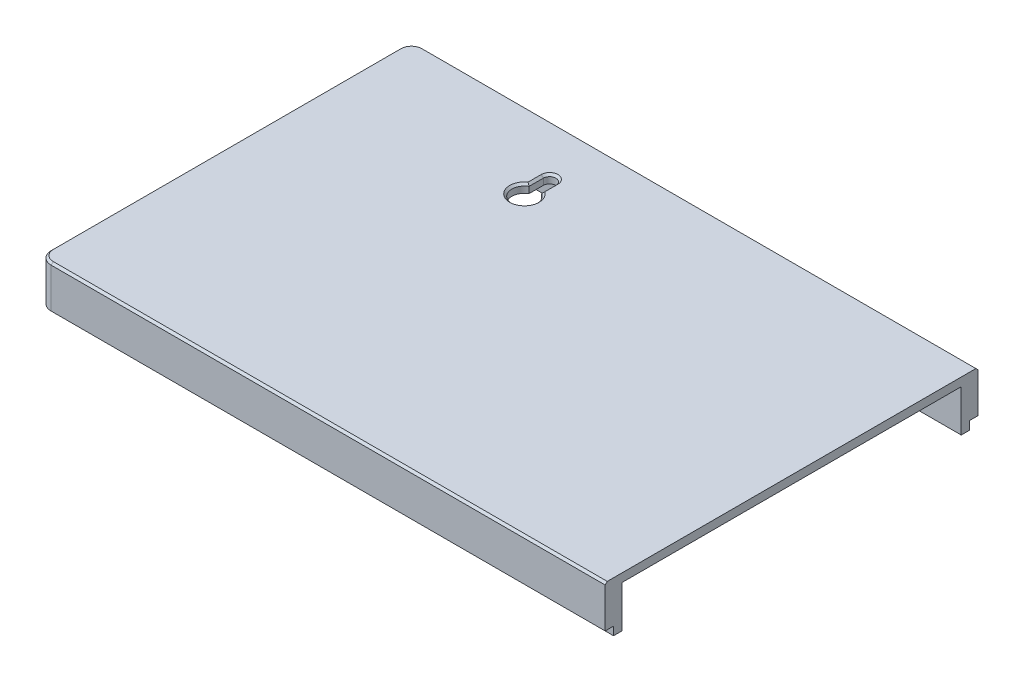
from build123d import *

# Parameters (mm, degrees)
SKETCH1_W           = 326.5
SKETCH1_H           = 85
SKETCH1_W_2         = 322.5
SKETCH1_H_2         = 81
BOSS_EXTRUDE1_DEPTH = 10
SKETCH2_W           = 330.5
SKETCH2_H           = 89
SKETCH2_W_2         = 322.5
SKETCH2_H_2         = 81
BOSS_EXTRUDE2_DEPTH = 8
SKETCH3_W           = 330.5
SKETCH3_H           = 89
BOSS_EXTRUDE3_DEPTH = 2
FILLET1_R           = 3
FILLET2_R           = 2
FILLET3_R           = 3
CHAMFER1_SIZE       = 0.5
CUT_EXTRUDE1_DEPTH  = 172.557024047
CHAMFER2_SIZE       = 0.5
SKETCH7_W           = 40
SKETCH7_H           = 6.166023439
CUT_EXTRUDE3_DEPTH  = 189.075948755
BOSS_EXTRUDE4_REACH = 190.076
FILLET4_R           = 2
CHAMFER3_SIZE       = 0.5
FILLET5_R           = 3
FILLET6_R           = 2
SKETCH9_R           = 16.25
SKETCH9_R_2         = 14.25
BOSS_EXTRUDE5_DEPTH = 3
SKETCH10_R          = 1.5
SKETCH10_R_2        = 2
SKETCH10_R_3        = 2.25
CUT_EXTRUDE4_DEPTH  = 172.279924393
CHAMFER4_SIZE       = 0.5
SKETCH12_W          = 30.6
SKETCH12_H          = 39
SKETCH12_W_2        = 26.6
SKETCH12_H_2        = 35
BOSS_EXTRUDE6_DEPTH = 6
SKETCH13_W          = 30.6
SKETCH13_H          = 4
BOSS_EXTRUDE7_DEPTH = 2.7
SKETCH14_W          = 3.373769955
SKETCH14_H          = 15.899358316
SKETCH14_W_2        = 15.312861043
SKETCH14_H_2        = 6.106571476
SKETCH14_W_3        = 6.70369678
SKETCH14_H_3        = 18.082973575
CUT_EXTRUDE5_DEPTH  = 6
FILLET7_R           = 2
CUT_EXTRUDE6_DEPTH  = 12.7
CUT_EXTRUDE7_DEPTH  = 12.7
CUT_EXTRUDE8_DEPTH  = 12.7
SKETCH19_W          = 25
SKETCH19_H          = 25.3
SKETCH19_W_2        = 21
SKETCH19_H_2        = 21.3
BOSS_EXTRUDE8_DEPTH = 6
SKETCH20_W          = 17
SKETCH20_H          = 11.292116592
CUT_EXTRUDE9_DEPTH  = 6
FILLET8_R           = 2
FILLET9_R           = 2
FILLET10_R          = 1
SKETCH18_W          = 231.079625222
SKETCH18_H          = 131.716143141
CUT_EXTRUDE11_DEPTH = 172.557024047


# Some blends are built 0.0001 mm under size
with BuildPart() as part:
    # Sketch1 → Boss-Extrude1 (new body)
    with BuildSketch(Plane(origin=(0, 0, 0), x_dir=(1, 0, 0), z_dir=(0, 1, 0))):
        Rectangle(SKETCH1_W, SKETCH1_H)
        Rectangle(SKETCH1_W_2, SKETCH1_H_2, mode=Mode.SUBTRACT)
    extrude(amount=BOSS_EXTRUDE1_DEPTH)

    # Sketch2 → Boss-Extrude2 (add)
    with BuildSketch(Plane(origin=(0, 10, 0), x_dir=(1, 0, 0), z_dir=(0, 1, 0))):
        Rectangle(SKETCH2_W, SKETCH2_H)
        Rectangle(SKETCH2_W_2, SKETCH2_H_2, mode=Mode.SUBTRACT)
    extrude(amount=-BOSS_EXTRUDE2_DEPTH)

    # Sketch3 → Boss-Extrude3 (add)
    with BuildSketch(Plane(origin=(0, 10, 0), x_dir=(1, 0, 0), z_dir=(0, 1, 0))):
        Rectangle(SKETCH3_W, SKETCH3_H)
    extrude(amount=BOSS_EXTRUDE3_DEPTH)

    # Fillet1
    fillet1_edges = [part.edges().sort_by_distance(p)[0] for p in [
        (161.25, 5, 40.5),
        (161.25, 5, -40.5),
        (-161.25, 5, -40.5),
        (-161.25, 5, 40.5),
    ]]
    fillet(fillet1_edges, radius=FILLET1_R)

    # Fillet2
    fillet2_edges = [part.edges().sort_by_distance(p)[0] for p in [
        (163.25, 1, 42.5),
        (-163.25, 1, 42.5),
        (-163.25, 1, -42.5),
        (163.25, 1, -42.5),
    ]]
    fillet(fillet2_edges, radius=FILLET2_R)

    # Fillet3
    fillet3_edges = [part.edges().sort_by_distance(p)[0] for p in [
        (165.25, 7, -44.5),
        (165.25, 7, 44.5),
        (-165.25, 7, 44.5),
        (-165.25, 7, -44.5),
    ]]
    fillet(fillet3_edges, radius=FILLET3_R)

    # Chamfer1
    chamfer1_edges = [part.edges().sort_by_distance(p)[0] for p in [
        (165.25, 12, 0),
        (-165.25, 12, 0),
        (0, 12, 44.5),
        (0, 12, -44.5),
        (-164.371320344, 12, -43.621320344),
        (-164.371320344, 12, 43.621320344),
        (164.371320344, 12, 43.621320344),
        (164.371320344, 12, -43.621320344),
    ]]
    chamfer(chamfer1_edges, length=CHAMFER1_SIZE)

    # Sketch4 → Cut-Extrude1 (cut, through all)
    with BuildSketch(Plane(origin=(0, 12, 0), x_dir=(1, 0, 0), z_dir=(0, 1, 0))):
        with BuildLine():
            Line((-121.5, 32.222687085), (-121.5, 28.820763297))
            ThreePointArc((-121.5, 28.820763297), (-120, 23.222687085), (-118.5, 28.820763297))
            Line((-118.5, 28.820763297), (-118.5, 32.222687085))
            ThreePointArc((-118.5, 32.222687085), (-120, 33.722687085), (-121.5, 32.222687085))
        make_face()
        with BuildLine():
            Line((118.5, 32.222687085), (118.5, 28.820763297))
            ThreePointArc((118.5, 28.820763297), (120, 23.222687085), (121.5, 28.820763297))
            Line((121.5, 28.820763297), (121.5, 32.222687085))
            ThreePointArc((121.5, 32.222687085), (120, 33.722687085), (118.5, 32.222687085))
        make_face()
    extrude(amount=-CUT_EXTRUDE1_DEPTH, mode=Mode.SUBTRACT)

    # Chamfer2
    chamfer2_edges = [part.edges().sort_by_distance(p)[0] for p in [
        (-120, 12, -33.722687085),
        (-121.5, 12, -30.521725191),
        (-120, 12, -23.222687085),
        (-118.5, 12, -30.521725191),
        (120, 12, -33.722687085),
        (118.5, 12, -30.521725191),
        (120, 12, -23.222687085),
        (121.5, 12, -30.521725191),
    ]]
    chamfer(chamfer2_edges, length=CHAMFER2_SIZE)

    # Sketch7 → Cut-Extrude3 (cut, through all)
    with BuildSketch(Plane(origin=(0, 0, -44.5), x_dir=(-1, 0, 0), z_dir=(0, 0, -1))):
        with Locations((0, 12.083011719)):
            Rectangle(SKETCH7_W, SKETCH7_H)
    extrude(amount=-CUT_EXTRUDE3_DEPTH, mode=Mode.SUBTRACT)

    # Boss-Extrude4: up to this face of the body (flat: up to its plane)
    boss_extrude4_end = Plane(part.part.faces().sort_by_distance((0, 6.63265862, 44.5))[0])
    # Sketch8 → Boss-Extrude4 (add, up to the picked face)
    with BuildSketch(Plane(origin=(0, 0, -44.5), x_dir=(-1, 0, 0), z_dir=(0, 0, -1)), mode=Mode.PRIVATE) as boss_extrude4_sk1:
        Polygon((-20, 12), (-20, 9), (20, 9), (20, 12), (22, 12), (22, 7), (-22, 7), (-22, 12), align=None)
    boss_extrude4_tool1 = split(extrude(boss_extrude4_sk1.sketch, amount=-BOSS_EXTRUDE4_REACH, mode=Mode.PRIVATE), bisect_by=boss_extrude4_end, keep=Keep.BOTH, mode=Mode.PRIVATE)
    add(boss_extrude4_tool1.solids().sort_by(Axis((0, 8.3, -44.5), (0, 0, 1)))[0])

    # Fillet4
    fillet4_edges = [part.edges().sort_by_distance(p)[0] for p in [
        (-20, 9, 0),
        (20, 9, 0),
    ]]
    fillet(fillet4_edges, radius=FILLET4_R)

    # Chamfer3
    # the kernel refuses this chamfer: 0.5 mm, written as the material it takes off along each edge
    with BuildSketch(Plane(origin=(22, 10.214158506, 44.5), x_dir=(-0.999621916911297, -2.130822274703722e-15, 0.027495876610582105), z_dir=(0, 1, 0))) as chamfer3_piece_1_section:
        Polygon((CHAMFER3_SIZE * 0.999621916911, -CHAMFER3_SIZE * 0.0274958766106), (-CHAMFER3_SIZE * 0.0274958766106, -CHAMFER3_SIZE * 0.999621916911), (0, 0), align=None)
    chamfer3_piece_1 = extrude(amount=3.071682988, mode=Mode.PRIVATE)
    chamfer3_piece_1 = split(chamfer3_piece_1, bisect_by=Plane(origin=(21.8125, 11.71875, 44.28125), z_dir=(0, 0.7071067811865476, 0.7071067811865476)), keep=Keep.TOP, mode=Mode.PRIVATE)
    add(chamfer3_piece_1, mode=Mode.SUBTRACT)
    with BuildSketch(Plane(origin=(-22, 12, -45.785841494), x_dir=(0.9996219169112968, 0.02749587661058555, 0), z_dir=(0, 0, 1))) as chamfer3_piece_2_section:
        Polygon((CHAMFER3_SIZE * 0.999621916911, -CHAMFER3_SIZE * 0.0274958766106), (-CHAMFER3_SIZE * 0.0274958766106, -CHAMFER3_SIZE * 0.999621916911), (0, 0), align=None)
    chamfer3_piece_2 = extrude(amount=3.071682988, mode=Mode.PRIVATE)
    chamfer3_piece_2 = split(chamfer3_piece_2, bisect_by=Plane(origin=(-21.8125, 11.78125, -44.21875), z_dir=(0, 0.7071067811865476, -0.7071067811865476)), keep=Keep.TOP, mode=Mode.PRIVATE)
    add(chamfer3_piece_2, mode=Mode.SUBTRACT)
    with BuildSketch(Plane(origin=(22, 12, -45.785841494), x_dir=(-0.9996219169112968, 0.02749587661058555, 0), z_dir=(0, 0, 1))) as chamfer3_piece_3_section:
        Polygon((CHAMFER3_SIZE * 0.999621916911, CHAMFER3_SIZE * 0.0274958766106), (-CHAMFER3_SIZE * 0.0274958766106, CHAMFER3_SIZE * 0.999621916911), (0, 0), align=None)
    chamfer3_piece_3 = extrude(amount=3.071682988, mode=Mode.PRIVATE)
    chamfer3_piece_3 = split(chamfer3_piece_3, bisect_by=Plane(origin=(21.8125, 11.78125, -44.21875), z_dir=(0, 0.7071067811865476, -0.7071067811865476)), keep=Keep.TOP, mode=Mode.PRIVATE)
    add(chamfer3_piece_3, mode=Mode.SUBTRACT)
    with BuildSketch(Plane(origin=(23.285841494, 12, -44.5), x_dir=(0, -0.999621916911297, -0.0274958766105822), z_dir=(-1, 0, 0)), Plane(origin=(-18.714158506, 12, -44.5), x_dir=(0, -0.999621916911297, -0.0274958766105822), z_dir=(-1, 0, 0)), Plane(origin=(-18.714158506, 12, 44.5), x_dir=(0, 0.02749587661058574, -0.9996219169112968), z_dir=(-1, 0, 0))) as chamfer3_piece_4:
        Polygon((CHAMFER3_SIZE * 0.999621916911, CHAMFER3_SIZE * 0.0274958766106), (-CHAMFER3_SIZE * 0.0274958766106, CHAMFER3_SIZE * 0.999621916911), (0, 0), align=None)
    extrude(amount=4.571682988, mode=Mode.SUBTRACT)
    with BuildSketch(Plane(origin=(22, 10.214158506, -44.5), x_dir=(-0.999621916911297, -2.130822274703722e-15, -0.027495876610582105), z_dir=(0, 1, 0))) as chamfer3_piece_5_section:
        Polygon((CHAMFER3_SIZE * 0.999621916911, CHAMFER3_SIZE * 0.0274958766106), (-CHAMFER3_SIZE * 0.0274958766106, CHAMFER3_SIZE * 0.999621916911), (0, 0), align=None)
    chamfer3_piece_5 = extrude(amount=3.071682988, mode=Mode.PRIVATE)
    chamfer3_piece_5 = split(chamfer3_piece_5, bisect_by=Plane(origin=(21.8125, 11.71875, -44.28125), z_dir=(0, 0.7071067811865476, -0.7071067811865476)), keep=Keep.TOP, mode=Mode.PRIVATE)
    add(chamfer3_piece_5, mode=Mode.SUBTRACT)
    with BuildSketch(Plane(origin=(-22, 13.285841494, -44.5), x_dir=(0.999621916911297, 0, -0.027495876610582105), z_dir=(0, -1, 0))) as chamfer3_piece_6_section:
        Polygon((CHAMFER3_SIZE * 0.999621916911, CHAMFER3_SIZE * 0.0274958766106), (-CHAMFER3_SIZE * 0.0274958766106, CHAMFER3_SIZE * 0.999621916911), (0, 0), align=None)
    chamfer3_piece_6 = extrude(amount=3.071682988, mode=Mode.PRIVATE)
    chamfer3_piece_6 = split(chamfer3_piece_6, bisect_by=Plane(origin=(-21.8125, 11.71875, -44.28125), z_dir=(0, 0.7071067811865476, -0.7071067811865476)), keep=Keep.TOP, mode=Mode.PRIVATE)
    add(chamfer3_piece_6, mode=Mode.SUBTRACT)
    with BuildSketch(Plane(origin=(-22, 12, 42.714158506), x_dir=(0.9996219169112968, 0.02749587661058555, 0), z_dir=(0, 0, 1))) as chamfer3_piece_7_section:
        Polygon((CHAMFER3_SIZE * 0.999621916911, -CHAMFER3_SIZE * 0.0274958766106), (-CHAMFER3_SIZE * 0.0274958766106, -CHAMFER3_SIZE * 0.999621916911), (0, 0), align=None)
    chamfer3_piece_7 = extrude(amount=3.071682988, mode=Mode.PRIVATE)
    chamfer3_piece_7 = split(chamfer3_piece_7, bisect_by=Plane(origin=(-21.8125, 11.78125, 44.21875), z_dir=(0, 0.7071067811865476, 0.7071067811865476)), keep=Keep.TOP, mode=Mode.PRIVATE)
    add(chamfer3_piece_7, mode=Mode.SUBTRACT)
    with BuildSketch(Plane(origin=(-22, 13.285841494, 44.5), x_dir=(0.999621916911297, 0, 0.027495876610582105), z_dir=(0, -1, 0))) as chamfer3_piece_8_section:
        Polygon((CHAMFER3_SIZE * 0.999621916911, -CHAMFER3_SIZE * 0.0274958766106), (-CHAMFER3_SIZE * 0.0274958766106, -CHAMFER3_SIZE * 0.999621916911), (0, 0), align=None)
    chamfer3_piece_8 = extrude(amount=3.071682988, mode=Mode.PRIVATE)
    chamfer3_piece_8 = split(chamfer3_piece_8, bisect_by=Plane(origin=(-21.8125, 11.71875, 44.28125), z_dir=(0, 0.7071067811865476, 0.7071067811865476)), keep=Keep.TOP, mode=Mode.PRIVATE)
    add(chamfer3_piece_8, mode=Mode.SUBTRACT)
    with BuildSketch(Plane(origin=(22, 12, 42.714158506), x_dir=(-0.9996219169112968, 0.02749587661058555, 0), z_dir=(0, 0, 1))) as chamfer3_piece_9_section:
        Polygon((CHAMFER3_SIZE * 0.999621916911, CHAMFER3_SIZE * 0.0274958766106), (-CHAMFER3_SIZE * 0.0274958766106, CHAMFER3_SIZE * 0.999621916911), (0, 0), align=None)
    chamfer3_piece_9 = extrude(amount=3.071682988, mode=Mode.PRIVATE)
    chamfer3_piece_9 = split(chamfer3_piece_9, bisect_by=Plane(origin=(21.8125, 11.78125, 44.21875), z_dir=(0, 0.7071067811865476, 0.7071067811865476)), keep=Keep.TOP, mode=Mode.PRIVATE)
    add(chamfer3_piece_9, mode=Mode.SUBTRACT)
    with BuildSketch(Plane(origin=(23.285841494, 12, 44.5), x_dir=(0, -0.999621916911297, 0.0274958766105822), z_dir=(-1, 0, 0))) as chamfer3_piece_10:
        Polygon((CHAMFER3_SIZE * 0.999621916911, -CHAMFER3_SIZE * 0.0274958766106), (-CHAMFER3_SIZE * 0.0274958766106, -CHAMFER3_SIZE * 0.999621916911), (0, 0), align=None)
    extrude(amount=4.571682988, mode=Mode.SUBTRACT)

    # Fillet5
    fillet5_edges = [part.edges().sort_by_distance(p)[0] for p in [
        (20, 11.25, 44.5),
        (19.414213562, 9.585786438, 44.5),
        (-20, 11.25, 44.5),
        (-19.414213562, 9.585786438, 44.5),
        (20, 11.25, -44.5),
        (19.414213562, 9.585786438, -44.5),
        (-20, 11.25, -44.5),
        (-19.414213562, 9.585786438, -44.5),
        (0, 9, -44.5),
        (0, 9, 44.5),
    ]]
    fillet(fillet5_edges, radius=FILLET5_R)

    # Fillet6
    fillet6_edges = [part.edges().sort_by_distance(p)[0] for p in [
        (22, 10, 0),
        (-22, 10, 0),
    ]]
    fillet(fillet6_edges, radius=FILLET6_R)

    # Sketch9 → Boss-Extrude5 (add)
    with BuildSketch(Plane.XZ.offset(-7)):
        Circle(SKETCH9_R)
        Circle(SKETCH9_R_2, mode=Mode.SUBTRACT)
    extrude(amount=BOSS_EXTRUDE5_DEPTH)

    # Sketch10 → Cut-Extrude4 (cut, through all)
    with BuildSketch(Plane.XZ.offset(-7)):
        with Locations((0, 3)):
            Circle(SKETCH10_R)
        with Locations((0, 7)):
            Circle(SKETCH10_R_2)
        with Locations((0, 12)):
            Circle(SKETCH10_R_3)
        with Locations((4.499513268, 5.362311102)):
            Circle(SKETCH10_R_2)
        with Locations((6.893654271, 1.215537244)):
            Circle(SKETCH10_R_2)
        with Locations((6.062177826, -3.5)):
            Circle(SKETCH10_R_2)
        with Locations((2.394141003, -6.577848346)):
            Circle(SKETCH10_R_2)
        with Locations((-2.394141003, -6.577848346)):
            Circle(SKETCH10_R_2)
        with Locations((-6.062177826, -3.5)):
            Circle(SKETCH10_R_2)
        with Locations((-6.893654271, 1.215537244)):
            Circle(SKETCH10_R_2)
        with Locations((-4.499513268, 5.362311102)):
            Circle(SKETCH10_R_2)
        with Locations((3, 0)):
            Circle(SKETCH10_R)
        with Locations((0, -3)):
            Circle(SKETCH10_R)
        with Locations((-3, 0)):
            Circle(SKETCH10_R)
        with Locations((5.576678065, 10.625472308)):
            Circle(SKETCH10_R_3)
        with Locations((9.875806391, 6.816776961)):
            Circle(SKETCH10_R_3)
        with Locations((11.912506489, 1.446440163)):
            Circle(SKETCH10_R_3)
        with Locations((11.220194912, -4.255258645)):
            Circle(SKETCH10_R_3)
        with Locations((7.957471899, -8.982128978)):
            Circle(SKETCH10_R_3)
        with Locations((2.871787971, -11.651301809)):
            Circle(SKETCH10_R_3)
        with Locations((-2.871787971, -11.651301809)):
            Circle(SKETCH10_R_3)
        with Locations((-7.957471899, -8.982128978)):
            Circle(SKETCH10_R_3)
        with Locations((-11.220194912, -4.255258645)):
            Circle(SKETCH10_R_3)
        with Locations((-11.912506489, 1.446440163)):
            Circle(SKETCH10_R_3)
        with Locations((-9.875806391, 6.816776961)):
            Circle(SKETCH10_R_3)
        with Locations((-5.576678065, 10.625472308)):
            Circle(SKETCH10_R_3)
    extrude(amount=-CUT_EXTRUDE4_DEPTH, mode=Mode.SUBTRACT)

    # Chamfer4
    chamfer4_edges = [part.edges().sort_by_distance(p)[0] for p in [
        (20, 12, 0),
        (20.356617963, 12, -42.918637165),
        (20.356617963, 12, 42.918637165),
        (-20, 12, 0),
        (-20.356617963, 12, -42.918637165),
        (-20.356617963, 12, 42.918637165),
    ]]
    chamfer(chamfer4_edges, length=CHAMFER4_SIZE - 0.0001)  # a hair under: the kernel refuses the full size

    # Sketch12 → Boss-Extrude6 (add)
    with BuildSketch(Plane.XZ.offset(-10)):
        with Locations((142.95, 3)):
            Rectangle(SKETCH12_W, SKETCH12_H)
        with Locations((142.95, 3)):
            Rectangle(SKETCH12_W_2, SKETCH12_H_2, mode=Mode.SUBTRACT)
    extrude(amount=BOSS_EXTRUDE6_DEPTH)

    # Sketch13 → Boss-Extrude7 (add)
    with BuildSketch(Plane.XZ.offset(-10)):
        with Locations((142.95, -14.5)):
            Rectangle(SKETCH13_W, SKETCH13_H)
    extrude(amount=BOSS_EXTRUDE7_DEPTH)

    # Sketch14 → Cut-Extrude5 (cut)
    with BuildSketch(Plane.XZ.offset(-4)):
        with Locations((157.936884978, 16.074384573)):
            Rectangle(SKETCH14_W, SKETCH14_H)
        with Locations((143.337214565, 21.464137582)):
            Rectangle(SKETCH14_W_2, SKETCH14_H_2)
        with Locations((129.195604024, 2.873540073)):
            Rectangle(SKETCH14_W_3, SKETCH14_H_3)
    extrude(amount=-CUT_EXTRUDE5_DEPTH, mode=Mode.SUBTRACT)

    # Fillet7
    fillet7_edges = [part.edges().sort_by_distance(p)[0] for p in [
        (150.993645086, 7, 20.5),
        (135.680784043, 7, 20.5),
        (129.65, 7, 11.91502686),
        (156.25, 7, 8.124705415),
        (129.65, 7, -6.167946715),
    ]]
    fillet(fillet7_edges, radius=FILLET7_R - 0.0001)  # a hair under: the kernel refuses the full size

    # Sketch15 → Cut-Extrude6 (cut)
    with BuildSketch(Plane.XY.offset(-40.5)):
        with BuildLine():
            Line((142.732418969, 8.83308219), (145.68707631, 8.83308219))
            ThreePointArc((145.68707631, 8.83308219), (146.85974764, 6.63308219), (145.68707631, 4.43308219))
            Line((145.68707631, 4.43308219), (142.732418969, 4.43308219))
            ThreePointArc((142.732418969, 4.43308219), (141.55974764, 6.63308219), (142.732418969, 8.83308219))
        make_face()
    extrude(amount=-CUT_EXTRUDE6_DEPTH, mode=Mode.SUBTRACT)

    # Sketch16 → Cut-Extrude7 (cut)
    with BuildSketch(Plane(origin=(0, 0, 40.5), x_dir=(-1, 0, 0), z_dir=(0, 0, -1))):
        with BuildLine():
            Line((-146.114315764, 9.98869973), (-139.089315764, 9.98869973))
            ThreePointArc((-139.089315764, 9.98869973), (-134.714315764, 5.61369973), (-139.089315764, 1.23869973))
            Line((-139.089315764, 1.23869973), (-146.114315764, 1.23869973))
            Line((-146.114315764, 1.23869973), (-146.114315764, 5.61369973))
            Line((-146.114315764, 5.61369973), (-146.114315764, 9.98869973))
        make_face()
    extrude(amount=-CUT_EXTRUDE7_DEPTH, mode=Mode.SUBTRACT)

    # Sketch17 → Cut-Extrude8 (cut)
    with BuildSketch(Plane.XY.offset(44.5)):
        Polygon((136.623185341, 2), (146.114315764, 4.571516723), (146.114315764, -5.033546584), (136.623185341, -4.403350122), align=None)
    extrude(amount=-CUT_EXTRUDE8_DEPTH, mode=Mode.SUBTRACT)

    # Sketch19 → Boss-Extrude8 (add)
    with BuildSketch(Plane.XZ.offset(-10)):
        with Locations((48.241330984, -14.734055582)):
            Rectangle(SKETCH19_W, SKETCH19_H)
        with Locations((48.241330984, -14.734055582)):
            Rectangle(SKETCH19_W_2, SKETCH19_H_2, mode=Mode.SUBTRACT)
    extrude(amount=BOSS_EXTRUDE8_DEPTH)

    # Sketch20 → Cut-Extrude9 (cut)
    with BuildSketch(Plane.XZ.offset(-4)):
        with Locations((48.241330984, -27.384055582)):
            Rectangle(SKETCH20_W, SKETCH20_H)
    extrude(amount=-CUT_EXTRUDE9_DEPTH, mode=Mode.SUBTRACT)

    # Fillet8
    fillet8_edges = [part.edges().sort_by_distance(p)[0] for p in [
        (39.741330984, 7, -25.384055582),
        (56.741330984, 7, -25.384055582),
    ]]
    fillet(fillet8_edges, radius=FILLET8_R - 0.0001)  # a hair under: the kernel refuses the full size

    # Fillet9
    fillet9_edges = [part.edges().sort_by_distance(p)[0] for p in [
        (60.741330984, 7, -2.084055582),
        (35.741330984, 7, -2.084055582),
        (158.25, 7, -16.5),
        (127.65, 7, 22.5),
        (127.65, 7, -16.5),
    ]]
    fillet(fillet9_edges, radius=FILLET9_R)

    # Fillet10
    fillet10_edges = [part.edges().sort_by_distance(p)[0] for p in [
        (-16.25, 4, 0),
        (-16.25, 7, 0),
        (-14.25, 4, 0),
    ]]
    fillet(fillet10_edges, radius=FILLET10_R - 0.0001)  # a hair under: the kernel refuses the full size

    # Sketch18 → Cut-Extrude11 (cut, through all)
    with BuildSketch(Plane(origin=(0, 12, 0), x_dir=(1, 0, 0), z_dir=(0, 1, 0))):
        with Locations((85.53434117, -3.596714528)):
            Rectangle(SKETCH18_W, SKETCH18_H)
    extrude(amount=-CUT_EXTRUDE11_DEPTH, mode=Mode.SUBTRACT)


solid = part.part
